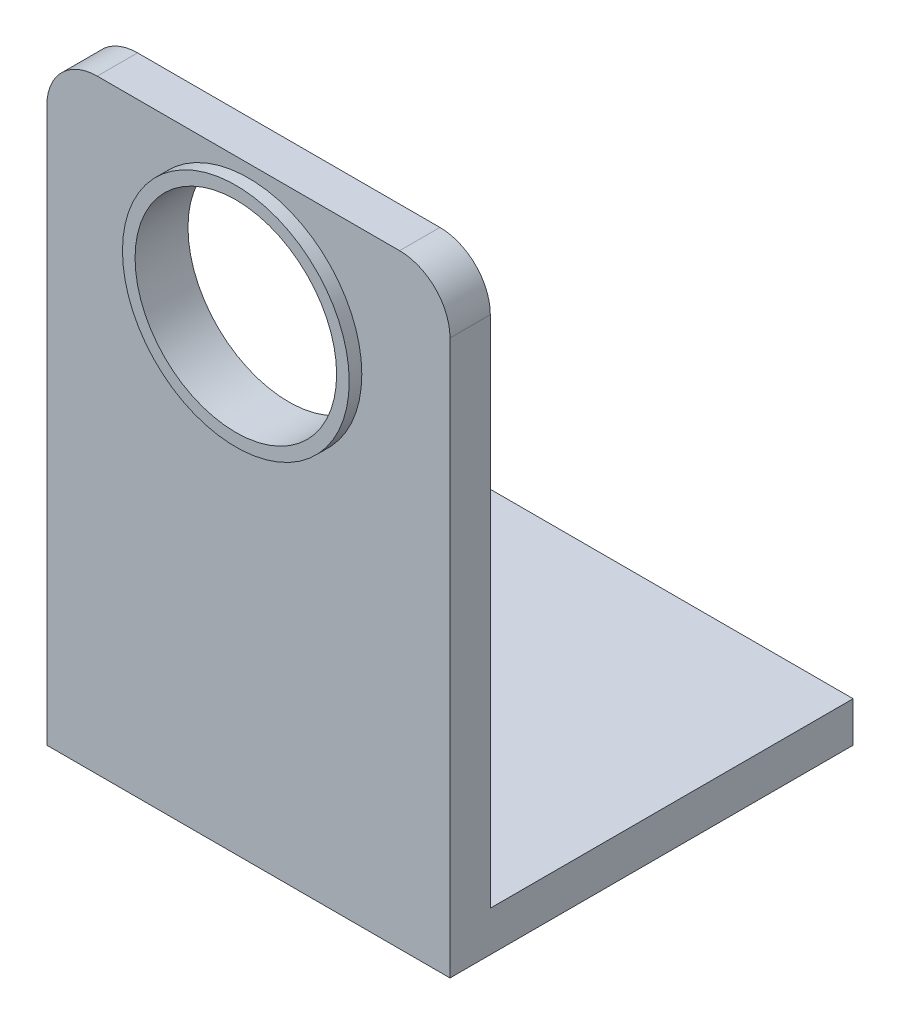
from build123d import *
from build123d.topology import SkipClean

# Parameters (mm, degrees)
BOSS_EXTRUDE1_DEPTH = 25.4
CUT_EXTRUDE1_REACH  = 53.18
SKETCH2_R           = 6.35
FILLET1_R           = 3.175
SKETCH3_R           = 7.14375
SKETCH3_R_2         = 6.35
BOSS_EXTRUDE2_DEPTH = 0.79375


with BuildPart() as part:
    # Sketch1 → Boss-Extrude1 (new body)
    with BuildSketch(Plane(origin=(0, 0, 0), x_dir=(0, 0, -1), z_dir=(1, 0, 0))):
        Polygon((2.54, 2.54), (25.4, 2.54), (25.4, 0), (0, 0), (0, 38.1), (2.54, 38.1), align=None)
    extrude(amount=BOSS_EXTRUDE1_DEPTH)

    # Sketch2 → Cut-Extrude1 (cut, up to next)
    with BuildSketch(Plane(origin=(0, 0, -2.54), x_dir=(-1, 0, 0), z_dir=(0, 0, -1)), mode=Mode.PRIVATE) as cut_extrude1_sk1:
        with Locations((-12.7, 30.1625)):
            Circle(SKETCH2_R)
    cut_extrude1_tool1 = extrude(cut_extrude1_sk1.sketch, amount=-CUT_EXTRUDE1_REACH, mode=Mode.PRIVATE) & part.part
    add(cut_extrude1_tool1.solids().sort_by_distance((12.7, 30.1625, -2.54))[0], mode=Mode.SUBTRACT)

    # Fillet1
    fillet1_edges = [part.edges().sort_by_distance(p)[0] for p in [
        (0, 38.1, -1.27),
        (25.4, 38.1, -1.27),
    ]]
    fillet(fillet1_edges, radius=FILLET1_R)

    # Sketch3 → Boss-Extrude2 (add)
    with SkipClean():  # the faces are left unmerged after this step: merging them gives an invalid solid
        with BuildSketch(Plane.XY):
            with Locations((12.7, 30.1625)):
                Circle(SKETCH3_R)
            with Locations((12.7, 30.1625)):
                Circle(SKETCH3_R_2, mode=Mode.SUBTRACT)
        extrude(amount=BOSS_EXTRUDE2_DEPTH)


solid = part.part
